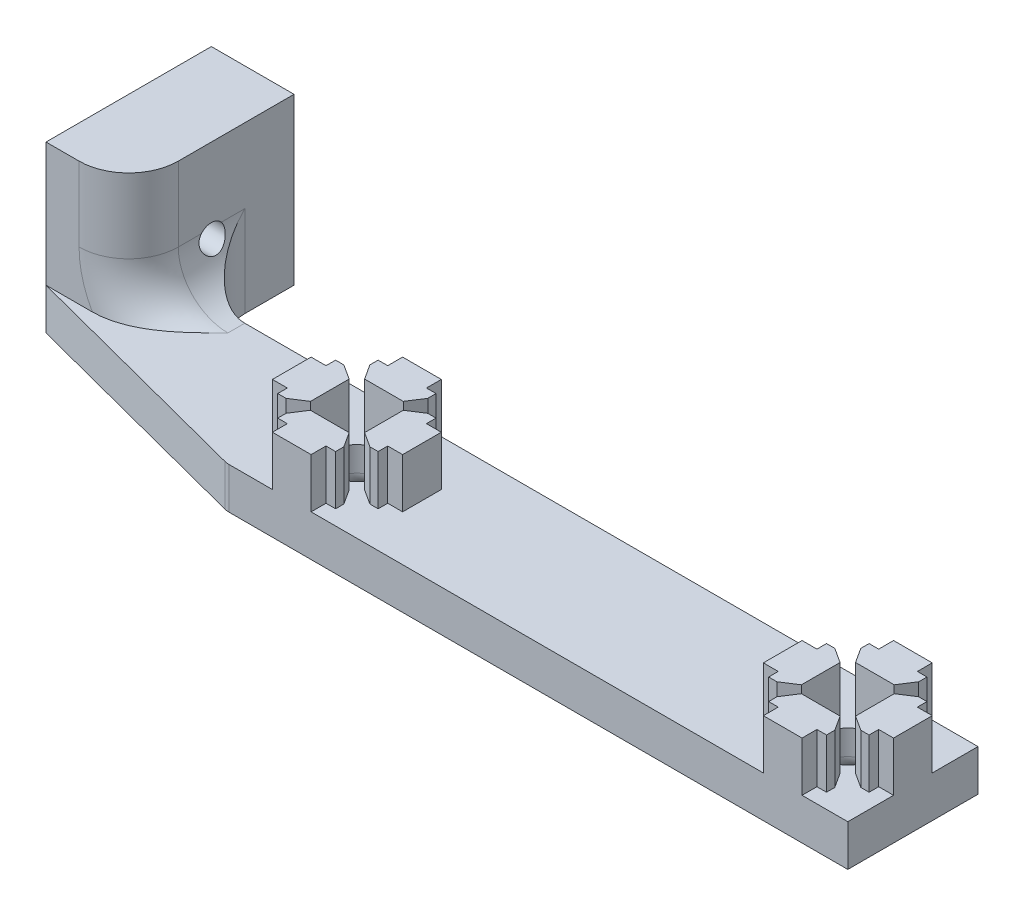
from build123d import *

# Parameters (mm, degrees)
BOSS_EXTRUDE1_DEPTH   = 7.62
BOSS_EXTRUDE1_2_DEPTH = 7.62
BOSS_EXTRUDE1_3_DEPTH = 7.62
BOSS_EXTRUDE1_4_DEPTH = 7.62
SKETCH2_W             = 132.9538108
SKETCH2_H             = 20
BOSS_EXTRUDE2_DEPTH   = 6.35
LPATTERN2_COUNT       = 2
LPATTERN2_PITCH       = 75.4126
CUT_EXTRUDE1_DEPTH    = 125.148300392
FILLET1_R             = 2.54
SKETCH6_W             = 25.4
SKETCH6_H             = 25.4
BOSS_EXTRUDE7_DEPTH   = 12.7
FILLET3_R             = 7.62
FILLET5_R             = 7.62
SKETCH11_R            = 1.984375
CUT_EXTRUDE3_DEPTH    = 137.653262418
SKETCH13_R            = 3.5
CUT_EXTRUDE5_DEPTH    = 127.945019246
FILLET6_R             = 2.54


with BuildPart() as part:
    # Sketch1 → Boss-Extrude1 (new body)
    with BuildSketch(Plane(origin=(0, 0, 0), x_dir=(1, 0, 0), z_dir=(0, 1, 0))):
        Polygon((-2.9718, 10), (-2.9718, 7.714), (-4.4450054, 7.714), (-4.4450054, 6.444), (-2.9718, 4.158), (2.9718, 4.158), (4.4449946, 6.444), (4.4449946, 7.714), (2.9718, 7.714), (2.9718, 10), align=None)
    boss_extrude1 = extrude(amount=BOSS_EXTRUDE1_DEPTH)



with BuildPart() as body_2:
    # Sketch1 → Boss-Extrude1 2 (new body)
    with BuildSketch(Plane(origin=(0, 0, 0), x_dir=(1, 0, 0), z_dir=(0, 1, 0))):
        Polygon((4.158, -2.9718), (4.158, 2.9718), (6.444, 4.4449946), (7.714, 4.4449946), (7.714, 2.9718), (10, 2.9718), (10, -2.9718), (7.714, -2.9718), (7.714, -4.4450054), (6.444, -4.4450054), align=None)
    boss_extrude1_2 = extrude(amount=BOSS_EXTRUDE1_2_DEPTH)


with BuildPart() as body_3:
    # Sketch1 → Boss-Extrude1 3 (new body)
    with BuildSketch(Plane(origin=(0, 0, 0), x_dir=(1, 0, 0), z_dir=(0, 1, 0))):
        Polygon((4.4450054, -6.444), (2.9718, -4.158), (-2.9718, -4.158), (-4.4449946, -6.444), (-4.4449946, -7.714), (-2.9718, -7.714), (-2.9718, -10), (2.9718, -10), (2.9718, -7.714), (4.4450054, -7.714), align=None)
    boss_extrude1_3 = extrude(amount=BOSS_EXTRUDE1_3_DEPTH)


with BuildPart() as body_4:
    # Sketch1 → Boss-Extrude1 4 (new body)
    with BuildSketch(Plane(origin=(0, 0, 0), x_dir=(1, 0, 0), z_dir=(0, 1, 0))):
        Polygon((-10, -2.9718), (-10, 2.9718), (-7.714, 2.9718), (-7.714, 4.4450054), (-6.444, 4.4450054), (-4.158, 2.9718), (-4.158, -2.9718), (-6.444, -4.4449946), (-7.714, -4.4449946), (-7.714, -2.9718), align=None)
    boss_extrude1_4 = extrude(amount=BOSS_EXTRUDE1_4_DEPTH)


with BuildPart() as part_1:
    add(part.part)

    add(body_2.part)  # Boss-Extrude2 merges body 2

    add(body_3.part)  # Boss-Extrude2 merges body 3

    add(body_4.part)  # Boss-Extrude2 merges body 4
    # Sketch2 → Boss-Extrude2 (add)
    with BuildSketch(Plane.XZ):
        with Locations((-56.4769054, 0)):
            Rectangle(SKETCH2_W, SKETCH2_H)
    extrude(amount=BOSS_EXTRUDE2_DEPTH)

    # LPattern2: Boss-Extrude1, Boss-Extrude1 2, Boss-Extrude1 3, Boss-Extrude1 4 ×2
    with Locations(*[(-i * LPATTERN2_PITCH, 0, 0) for i in range(1, LPATTERN2_COUNT)]):
        add(boss_extrude1)
        add(boss_extrude1_2)
        add(boss_extrude1_3)
        add(boss_extrude1_4)

    # Sketch4 → Cut-Extrude1 (cut, through all)
    with BuildSketch(Plane(origin=(0, -6.35, 0), x_dir=(-1, 0, 0), z_dir=(0, -1, 0))):
        Polygon((122.9538108, -10), (85.4126108, -10), (122.9538108, -0.2108), align=None)
    extrude(amount=-CUT_EXTRUDE1_DEPTH, mode=Mode.SUBTRACT)

    # Fillet1
    fillet1_edges = [part_1.edges().sort_by_distance(p)[0] for p in [
        (-85.4126108, -3.175, 10),
    ]]
    fillet(fillet1_edges, radius=FILLET1_R)

    # Sketch6 → Boss-Extrude7 (add)
    with BuildSketch(Plane.ZY.offset(122.9538108)):
        with Locations((-12.4892, 6.35)):
            Rectangle(SKETCH6_W, SKETCH6_H)
    extrude(amount=-BOSS_EXTRUDE7_DEPTH)

    # Fillet3
    fillet3_edges = [part_1.edges().sort_by_distance(p)[0] for p in [
        (-110.2538108, 0, -4.8946),
        (-110.2538108, -3.175, -10),
    ]]
    fillet(fillet3_edges, radius=FILLET3_R)

    # Fillet5
    # the kernel refuses this fillet: 7.62 mm, written as the material it takes off along each edge
    with BuildSketch(Plane(origin=(-110.2538108, 38.1, 0.2108), x_dir=(-1, 0, 0), z_dir=(0, -1, 0))) as fillet5_piece_1:
        with BuildLine():
            CenterArc((FILLET5_R, FILLET5_R), FILLET5_R, 180, 90)
            Line((0, FILLET5_R), (0, 0))
            Line((0, 0), (FILLET5_R, 0))
        make_face()
    extrude(amount=30.48, mode=Mode.SUBTRACT)
    with BuildSketch(Plane(origin=(-102.6338108, 7.62, 0.2108), x_dir=(0.5976672776328267, 0.8017442392976488, 0), z_dir=(-0.8017442392976488, 0.5976672776328267, 0))) as fillet5_piece_2_section:
        with BuildLine():
            CenterArc((7.62 + FILLET5_R, FILLET5_R), FILLET5_R, 180, 90)
            Line((7.62, FILLET5_R), (7.62, 0))
            Line((7.62, 0), (7.62 + FILLET5_R, 0))
        make_face()
    fillet5_piece_2 = revolve(axis=Axis((-102.6338108, 7.62, 0.2108), (0, 0, -1)), revolution_arc=233.296989237, mode=Mode.PRIVATE)
    fillet5_piece_2 = split(fillet5_piece_2, bisect_by=Plane(origin=(-108.348345601, 0, -2.163807766), z_dir=(0, 1, 0)), keep=Keep.TOP, mode=Mode.PRIVATE)
    add(fillet5_piece_2, mode=Mode.SUBTRACT)

    # Sketch11 → Cut-Extrude3 (cut, through all)
    with BuildSketch(Plane.ZY.offset(122.9538108)):
        with Locations((-12.4892, 6.35)):
            Circle(SKETCH11_R)
    extrude(amount=-CUT_EXTRUDE3_DEPTH, mode=Mode.SUBTRACT)

    # Sketch13 → Cut-Extrude5 (cut, through all)
    with BuildSketch(Plane(origin=(0, 0, 0), x_dir=(1, 0, 0), z_dir=(0, 1, 0))):
        with Locations(Location((0, 0, 0), (0, 0, 270))):
            Circle(SKETCH13_R)
        with Locations(Location((-75.4126, 0, 0), (0, 0, 270))):
            Circle(SKETCH13_R)
    extrude(amount=-CUT_EXTRUDE5_DEPTH, mode=Mode.SUBTRACT)

    # Fillet6
    fillet6_edges = [part_1.edges().sort_by_distance(p)[0] for p in [
        (0, -6.35, -3.5),
        (-75.4126, -6.35, -3.5),
    ]]
    fillet(fillet6_edges, radius=FILLET6_R)


solid = part_1.part
